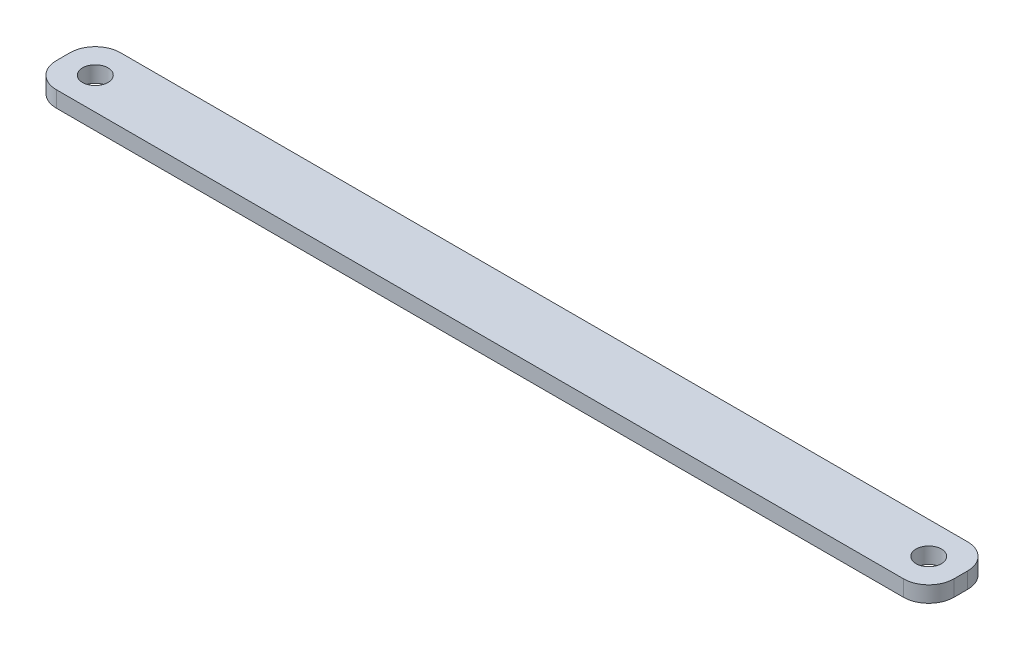
from build123d import *

# Parameters (mm, degrees)
SKETCH1_W               = 355.6
SKETCH1_H               = 25.4
BOSS_EXTRUDE1_DEPTH     = 3.175
FILLET1_R               = 10
F_3_8_CLEARANCE_HOLE1_D = 10.0838


with BuildPart() as part:
    # Sketch1 → Boss-Extrude1 (new, symmetric)
    with BuildSketch(Plane(origin=(0, 0, 0), x_dir=(1, 0, 0), z_dir=(0, 1, 0))):
        Rectangle(SKETCH1_W, SKETCH1_H)
    extrude(amount=BOSS_EXTRUDE1_DEPTH, both=True)

    # Fillet1
    fillet1_edges = [part.edges().sort_by_distance(p)[0] for p in [
        (177.8, 0, -12.7),
        (177.8, 0, 12.7),
        (-177.8, 0, -12.7),
        (-177.8, 0, 12.7),
    ]]
    fillet(fillet1_edges, radius=FILLET1_R)

    # 3/8 Clearance Hole1 (through all)
    with Locations(Plane(origin=(0, 3.175, 0), x_dir=(1, 0, 0), z_dir=(0, 1, 0))):
        with Locations((165.1, 0), (-165.1, 0)):
            Hole(F_3_8_CLEARANCE_HOLE1_D / 2)


solid = part.part
